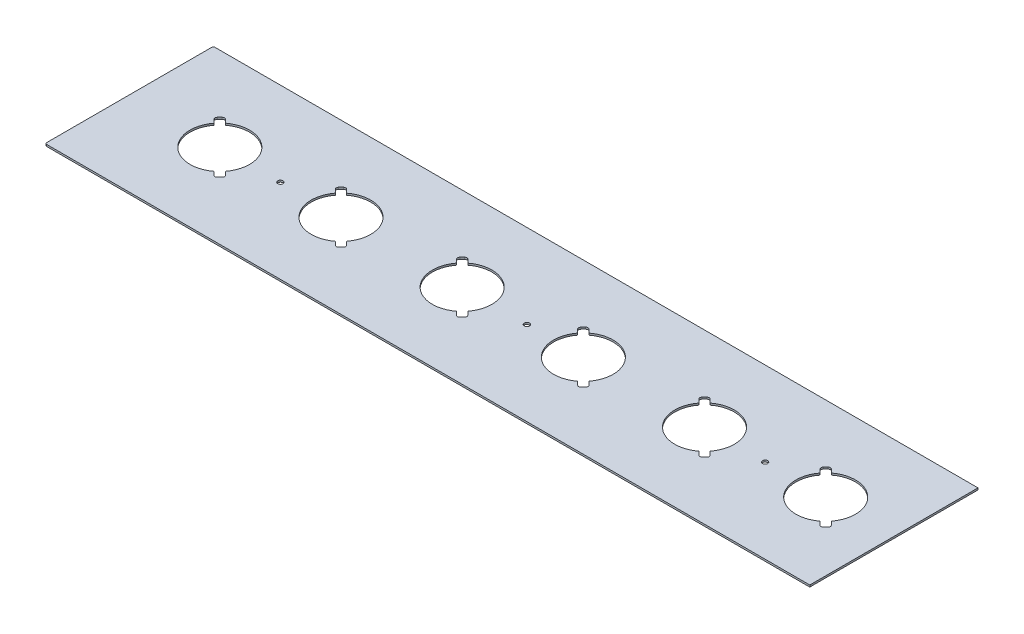
from build123d import *

# Parameters (mm, degrees)
SKETCH2_W             = 635
SKETCH2_H             = 139.7
BOSS_EXTRUDE1_DEPTH   = 1.524
FILLET1_R             = 1.27
F_8_CLEARANCE_HOLE1_D = 4.3053


with BuildPart() as part:
    # Sketch2 → Boss-Extrude1 (new body)
    with BuildSketch(Plane(origin=(0, 0, 0), x_dir=(1, 0, 0), z_dir=(0, 1, 0))):
        Rectangle(SKETCH2_W, SKETCH2_H)
        with BuildLine():
            Line((179.944296349, -14.945480915), (182.79989864, -17.801083206))
            ThreePointArc((182.79989864, -17.801083206), (183.385685078, -19.215296769), (182.79989864, -20.629510331))
            Line((182.79989864, -20.629510331), (180.890710331, -22.53869864))
            ThreePointArc((180.890710331, -22.53869864), (179.476496769, -23.124485078), (178.062283206, -22.53869864))
            Line((178.062283206, -22.53869864), (175.206680915, -19.683096349))
            ThreePointArc((175.206680915, -19.683096349), (142.785621588, -17.475578412), (140.578103651, 14.945480915))
            Line((140.578103651, 14.945480915), (137.72250136, 17.801083206))
            ThreePointArc((137.72250136, 17.801083206), (137.136714922, 19.215296769), (137.72250136, 20.629510331))
            Line((137.72250136, 20.629510331), (139.631689669, 22.53869864))
            ThreePointArc((139.631689669, 22.53869864), (141.045903231, 23.124485078), (142.460116794, 22.53869864))
            Line((142.460116794, 22.53869864), (145.315719085, 19.683096349))
            ThreePointArc((145.315719085, 19.683096349), (177.736778412, 17.475578412), (179.944296349, -14.945480915))
        make_face(mode=Mode.SUBTRACT)
        with BuildLine():
            Line((243.094916794, 22.53869864), (245.950519085, 19.683096349))
            ThreePointArc((245.950519085, 19.683096349), (278.371578412, 17.475578412), (280.579096349, -14.945480915))
            Line((280.579096349, -14.945480915), (283.43469864, -17.801083206))
            ThreePointArc((283.43469864, -17.801083206), (284.020485078, -19.215296769), (283.43469864, -20.629510331))
            Line((283.43469864, -20.629510331), (281.525510331, -22.53869864))
            ThreePointArc((281.525510331, -22.53869864), (280.111296769, -23.124485078), (278.697083206, -22.53869864))
            Line((278.697083206, -22.53869864), (275.841480915, -19.683096349))
            ThreePointArc((275.841480915, -19.683096349), (243.420421588, -17.475578412), (241.212903651, 14.945480915))
            Line((241.212903651, 14.945480915), (238.35730136, 17.801083206))
            ThreePointArc((238.35730136, 17.801083206), (237.771514922, 19.215296769), (238.35730136, 20.629510331))
            Line((238.35730136, 20.629510331), (240.266489669, 22.53869864))
            ThreePointArc((240.266489669, 22.53869864), (241.680703231, 23.124485078), (243.094916794, 22.53869864))
        make_face(mode=Mode.SUBTRACT)
        with BuildLine():
            Line((39.943303651, 14.945480915), (37.08770136, 17.801083206))
            ThreePointArc((37.08770136, 17.801083206), (36.501914922, 19.215296769), (37.08770136, 20.629510331))
            Line((37.08770136, 20.629510331), (38.996889669, 22.53869864))
            ThreePointArc((38.996889669, 22.53869864), (40.411103231, 23.124485078), (41.825316794, 22.53869864))
            Line((41.825316794, 22.53869864), (44.680919085, 19.683096349))
            ThreePointArc((44.680919085, 19.683096349), (77.101978412, 17.475578412), (79.309496349, -14.945480915))
            Line((79.309496349, -14.945480915), (82.16509864, -17.801083206))
            ThreePointArc((82.16509864, -17.801083206), (82.750885078, -19.215296769), (82.16509864, -20.629510331))
            Line((82.16509864, -20.629510331), (80.255910331, -22.53869864))
            ThreePointArc((80.255910331, -22.53869864), (78.841696769, -23.124485078), (77.427483206, -22.53869864))
            Line((77.427483206, -22.53869864), (74.571880915, -19.683096349))
            ThreePointArc((74.571880915, -19.683096349), (42.150821588, -17.475578412), (39.943303651, 14.945480915))
        make_face(mode=Mode.SUBTRACT)
        with BuildLine():
            Line((-60.691496349, 14.945480915), (-63.54709864, 17.801083206))
            ThreePointArc((-63.54709864, 17.801083206), (-64.132885078, 19.215296769), (-63.54709864, 20.629510331))
            Line((-63.54709864, 20.629510331), (-61.637910331, 22.53869864))
            ThreePointArc((-61.637910331, 22.53869864), (-60.223696769, 23.124485078), (-58.809483206, 22.53869864))
            Line((-58.809483206, 22.53869864), (-55.953880915, 19.683096349))
            ThreePointArc((-55.953880915, 19.683096349), (-23.532821588, 17.475578412), (-21.325303651, -14.945480915))
            Line((-21.325303651, -14.945480915), (-18.46970136, -17.801083206))
            ThreePointArc((-18.46970136, -17.801083206), (-17.883914922, -19.215296769), (-18.46970136, -20.629510331))
            Line((-18.46970136, -20.629510331), (-20.378889669, -22.53869864))
            ThreePointArc((-20.378889669, -22.53869864), (-21.793103231, -23.124485078), (-23.207316794, -22.53869864))
            Line((-23.207316794, -22.53869864), (-26.062919085, -19.683096349))
            ThreePointArc((-26.062919085, -19.683096349), (-58.483978412, -17.475578412), (-60.691496349, 14.945480915))
        make_face(mode=Mode.SUBTRACT)
        with BuildLine():
            Line((-161.326296349, 14.945480915), (-164.18189864, 17.801083206))
            ThreePointArc((-164.18189864, 17.801083206), (-164.767685078, 19.215296769), (-164.18189864, 20.629510331))
            Line((-164.18189864, 20.629510331), (-162.272710331, 22.53869864))
            ThreePointArc((-162.272710331, 22.53869864), (-160.858496769, 23.124485078), (-159.444283206, 22.53869864))
            Line((-159.444283206, 22.53869864), (-156.588680915, 19.683096349))
            ThreePointArc((-156.588680915, 19.683096349), (-124.167621588, 17.475578412), (-121.960103651, -14.945480915))
            Line((-121.960103651, -14.945480915), (-119.10450136, -17.801083206))
            ThreePointArc((-119.10450136, -17.801083206), (-118.518714922, -19.215296769), (-119.10450136, -20.629510331))
            Line((-119.10450136, -20.629510331), (-121.013689669, -22.53869864))
            ThreePointArc((-121.013689669, -22.53869864), (-122.427903231, -23.124485078), (-123.842116794, -22.53869864))
            Line((-123.842116794, -22.53869864), (-126.697719085, -19.683096349))
            ThreePointArc((-126.697719085, -19.683096349), (-159.118778412, -17.475578412), (-161.326296349, 14.945480915))
        make_face(mode=Mode.SUBTRACT)
        with BuildLine():
            Line((-222.594903651, -14.945480915), (-219.73930136, -17.801083206))
            ThreePointArc((-219.73930136, -17.801083206), (-219.153514922, -19.215296769), (-219.73930136, -20.629510331))
            Line((-219.73930136, -20.629510331), (-221.648489669, -22.53869864))
            ThreePointArc((-221.648489669, -22.53869864), (-223.062703231, -23.124485078), (-224.476916794, -22.53869864))
            Line((-224.476916794, -22.53869864), (-227.332519085, -19.683096349))
            ThreePointArc((-227.332519085, -19.683096349), (-259.753578412, -17.475578412), (-261.961096349, 14.945480915))
            Line((-261.961096349, 14.945480915), (-264.81669864, 17.801083206))
            ThreePointArc((-264.81669864, 17.801083206), (-265.402485078, 19.215296769), (-264.81669864, 20.629510331))
            Line((-264.81669864, 20.629510331), (-262.907510331, 22.53869864))
            ThreePointArc((-262.907510331, 22.53869864), (-261.493296769, 23.124485078), (-260.079083206, 22.53869864))
            Line((-260.079083206, 22.53869864), (-257.223480915, 19.683096349))
            ThreePointArc((-257.223480915, 19.683096349), (-224.802421588, 17.475578412), (-222.594903651, -14.945480915))
        make_face(mode=Mode.SUBTRACT)
    extrude(amount=BOSS_EXTRUDE1_DEPTH)

    # Fillet1
    fillet1_edges = [part.edges().sort_by_distance(p)[0] for p in [
        (-317.5, 0.762, 69.85),
        (-317.5, 0.762, -69.85),
    ]]
    fillet(fillet1_edges, radius=FILLET1_R)

    # #8 Clearance Hole1 (through all)
    with Locations(Plane(origin=(0, 1.524, 0), x_dir=(1, 0, 0), z_dir=(0, 1, 0))):
        with Locations((210.5786, 0), (12.7, 0), (-191.9606, 0)):
            Hole(F_8_CLEARANCE_HOLE1_D / 2)


solid = part.part
